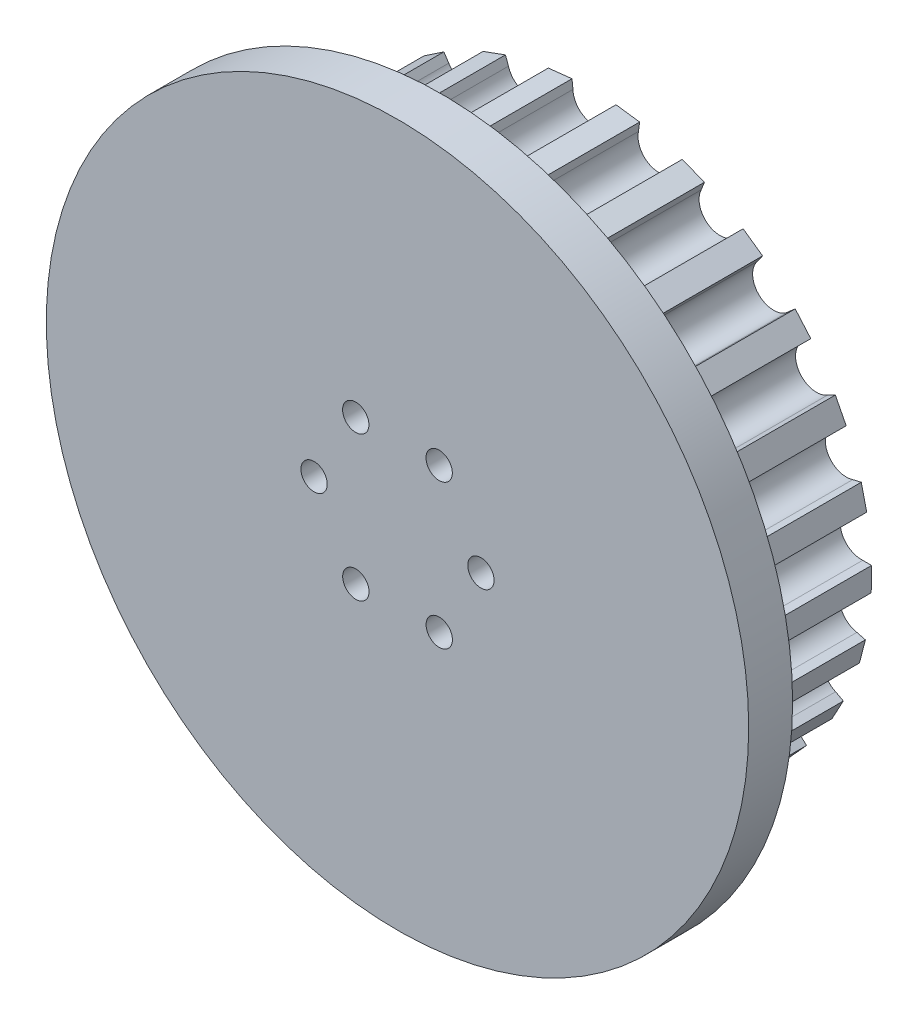
from build123d import *

# Parameters (mm, degrees)
BOSS_EXTRUDE4_DEPTH = 17
SKETCH6_R           = 40
BOSS_EXTRUDE5_DEPTH = 5
SKETCH9_R           = 22.5
CUT_EXTRUDE2_DEPTH  = 8.91448242
SKETCH10_R          = 1.5
CUT_EXTRUDE3_DEPTH  = 59.062300767


with BuildPart() as part:
    # Sketch2 → Boss-Extrude4 (new body)
    with BuildSketch(Plane.XY):
        with BuildLine():
            ThreePointArc((2.753920794, 30.877433835), (0.34063079, 28.610074808), (-2.017992552, 30.934248109))
            Line((-2.017992552, 30.934248109), (-2.126702362, 31.928321636))
            Line((-2.126702362, 31.928321636), (-4.824266539, 31.633321637))
            Line((-4.824266539, 31.633321637), (-4.715556729, 30.63924811))
            ThreePointArc((-4.715556729, 30.63924811), (-6.51610638, 27.860236315), (-9.362403491, 29.552417851))
            Line((-9.362403491, 29.552417851), (-9.705851758, 30.491589448))
            Line((-9.705851758, 30.491589448), (-12.254431503, 29.55959225))
            Line((-12.254431503, 29.55959225), (-11.910983235, 28.620420653))
            ThreePointArc((-11.910983235, 28.620420653), (-12.994151132, 25.491262155), (-16.162705571, 26.453108487))
            Line((-16.162705571, 26.453108487), (-16.72093233, 27.282796914))
            Line((-16.72093233, 27.282796914), (-18.97241345, 25.767966806))
            Line((-18.97241345, 25.767966806), (-18.414186691, 24.938278379))
            ThreePointArc((-18.414186691, 24.938278379), (-18.717023052, 21.640828495), (-22.023689951, 21.816440611))
            Line((-22.023689951, 21.816440611), (-22.764253092, 22.488427392))
            Line((-22.764253092, 22.488427392), (-24.587787689, 20.478800794))
            Line((-24.587787689, 20.478800794), (-23.847224548, 19.806814013))
            ThreePointArc((-23.847224548, 19.806814013), (-23.352129626, 16.532708544), (-26.604737525, 15.911880506))
            Line((-26.604737525, 15.911880506), (-27.48459821, 16.387112212))
            Line((-27.48459821, 16.387112212), (-28.774209082, 13.999481317))
            Line((-28.774209082, 13.999481317), (-27.894348397, 13.524249611))
            ThreePointArc((-27.894348397, 13.524249611), (-26.630095307, 10.463767667), (-29.639614458, 9.082579743))
            Line((-29.639614458, 9.082579743), (-30.607638382, 9.333437635))
            Line((-30.607638382, 9.333437635), (-31.288378032, 6.706562873))
            Line((-31.288378032, 6.706562873), (-30.320354108, 6.45570498))
            ThreePointArc((-30.320354108, 6.45570498), (-28.360416646, 3.786710647), (-30.951944734, 1.725432459))
            Line((-30.951944734, 1.725432459), (-31.951873866, 1.737337589))
            Line((-31.951873866, 1.737337589), (-31.984180179, -0.976116629))
            Line((-31.984180179, -0.976116629), (-30.984251048, -0.988021759))
            ThreePointArc((-30.984251048, -0.988021759), (-28.442533655, -3.110416231), (-30.465460488, -5.731990687))
            Line((-30.465460488, -5.731990687), (-31.43918258, -5.959730203))
            Line((-31.43918258, -5.959730203), (-30.821178033, -8.60206778))
            Line((-30.821178033, -8.60206778), (-29.847455941, -8.374328264))
            ThreePointArc((-29.847455941, -8.374328264), (-26.871673993, -9.826777024), (-28.208434416, -12.85629137))
            Line((-28.208434416, -12.85629137), (-29.09936028, -13.310440139))
            Line((-29.09936028, -13.310440139), (-27.866961049, -15.728098019))
            Line((-27.866961049, -15.728098019), (-26.976035185, -15.27394925))
            ThreePointArc((-26.976035185, -15.27394925), (-23.739130313, -15.972041255), (-24.312036669, -19.233431129))
            Line((-24.312036669, -19.233431129), (-25.068388933, -19.887595675))
            Line((-25.068388933, -19.887595675), (-23.293217582, -21.94006837))
            Line((-23.293217582, -21.94006837), (-22.536865318, -21.285903824))
            ThreePointArc((-22.536865318, -21.285903824), (-19.226954667, -21.189068505), (-19.002711722, -24.492793781))
            Line((-19.002711722, -24.492793781), (-19.58053394, -25.308956439))
            Line((-19.58053394, -25.308956439), (-17.365756976, -26.876961697))
            Line((-17.365756976, -26.876961697), (-16.787934758, -26.060799039))
            ThreePointArc((-16.787934758, -26.060799039), (-13.597378303, -25.174664112), (-12.589018241, -28.328724287))
            Line((-12.589018241, -28.328724287), (-12.954729488, -29.259452649))
            Line((-12.954729488, -29.259452649), (-10.429061697, -30.251863704))
            Line((-10.429061697, -30.251863704), (-10.063350451, -29.321135341))
            ThreePointArc((-10.063350451, -29.321135341), (-7.177571736, -27.697199747), (-5.44369678, -30.518292308))
            Line((-5.44369678, -30.518292308), (-5.576043245, -31.509495825))
            Line((-5.576043245, -31.509495825), (-2.88626726, -31.868637353))
            Line((-2.88626726, -31.868637353), (-2.753920794, -30.877433835))
            ThreePointArc((-2.753920794, -30.877433835), (-0.34063079, -28.610074808), (2.017992552, -30.934248109))
            Line((2.017992552, -30.934248109), (2.126702362, -31.928321636))
            Line((2.126702362, -31.928321636), (4.824266539, -31.633321637))
            Line((4.824266539, -31.633321637), (4.715556729, -30.63924811))
            ThreePointArc((4.715556729, -30.63924811), (6.51610638, -27.860236315), (9.362403491, -29.552417851))
            Line((9.362403491, -29.552417851), (9.705851758, -30.491589448))
            Line((9.705851758, -30.491589448), (12.254431503, -29.55959225))
            Line((12.254431503, -29.55959225), (11.910983235, -28.620420653))
            ThreePointArc((11.910983235, -28.620420653), (12.994151132, -25.491262155), (16.162705571, -26.453108487))
            Line((16.162705571, -26.453108487), (16.72093233, -27.282796914))
            Line((16.72093233, -27.282796914), (18.97241345, -25.767966806))
            Line((18.97241345, -25.767966806), (18.414186691, -24.938278379))
            ThreePointArc((18.414186691, -24.938278379), (18.717023052, -21.640828495), (22.023689951, -21.816440611))
            Line((22.023689951, -21.816440611), (22.764253092, -22.488427392))
            Line((22.764253092, -22.488427392), (24.587787689, -20.478800794))
            Line((24.587787689, -20.478800794), (23.847224548, -19.806814013))
            ThreePointArc((23.847224548, -19.806814013), (23.352129626, -16.532708544), (26.604737525, -15.911880506))
            Line((26.604737525, -15.911880506), (27.48459821, -16.387112212))
            Line((27.48459821, -16.387112212), (28.774209082, -13.999481317))
            Line((28.774209082, -13.999481317), (27.894348397, -13.524249611))
            ThreePointArc((27.894348397, -13.524249611), (26.630095307, -10.463767667), (29.639614458, -9.082579743))
            Line((29.639614458, -9.082579743), (30.607638382, -9.333437635))
            Line((30.607638382, -9.333437635), (31.288378032, -6.706562873))
            Line((31.288378032, -6.706562873), (30.320354108, -6.45570498))
            ThreePointArc((30.320354108, -6.45570498), (28.360416646, -3.786710647), (30.951944734, -1.725432459))
            Line((30.951944734, -1.725432459), (31.951873866, -1.737337589))
            Line((31.951873866, -1.737337589), (31.984180179, 0.976116629))
            Line((31.984180179, 0.976116629), (30.984251048, 0.988021759))
            ThreePointArc((30.984251048, 0.988021759), (28.442533655, 3.110416231), (30.465460488, 5.731990687))
            Line((30.465460488, 5.731990687), (31.43918258, 5.959730203))
            Line((31.43918258, 5.959730203), (30.821178033, 8.60206778))
            Line((30.821178033, 8.60206778), (29.847455941, 8.374328264))
            ThreePointArc((29.847455941, 8.374328264), (26.871673993, 9.826777024), (28.208434416, 12.85629137))
            Line((28.208434416, 12.85629137), (29.09936028, 13.310440139))
            Line((29.09936028, 13.310440139), (27.866961049, 15.728098019))
            Line((27.866961049, 15.728098019), (26.976035185, 15.27394925))
            ThreePointArc((26.976035185, 15.27394925), (23.739130313, 15.972041255), (24.312036669, 19.233431129))
            Line((24.312036669, 19.233431129), (25.068388933, 19.887595675))
            Line((25.068388933, 19.887595675), (23.293217582, 21.94006837))
            Line((23.293217582, 21.94006837), (22.536865318, 21.285903824))
            ThreePointArc((22.536865318, 21.285903824), (19.226954667, 21.189068505), (19.002711722, 24.492793781))
            Line((19.002711722, 24.492793781), (19.58053394, 25.308956439))
            Line((19.58053394, 25.308956439), (17.365756976, 26.876961697))
            Line((17.365756976, 26.876961697), (16.787934758, 26.060799039))
            ThreePointArc((16.787934758, 26.060799039), (13.597378303, 25.174664112), (12.589018241, 28.328724287))
            Line((12.589018241, 28.328724287), (12.954729488, 29.259452649))
            Line((12.954729488, 29.259452649), (10.429061697, 30.251863704))
            Line((10.429061697, 30.251863704), (10.063350451, 29.321135341))
            ThreePointArc((10.063350451, 29.321135341), (7.177571736, 27.697199747), (5.44369678, 30.518292308))
            Line((5.44369678, 30.518292308), (5.576043245, 31.509495825))
            Line((5.576043245, 31.509495825), (2.88626726, 31.868637353))
            Line((2.88626726, 31.868637353), (2.753920794, 30.877433835))
        make_face()
    extrude(amount=-BOSS_EXTRUDE4_DEPTH)

    # Sketch6 → Boss-Extrude5 (add)
    with BuildSketch(Plane.XY):
        Circle(SKETCH6_R)
    extrude(amount=BOSS_EXTRUDE5_DEPTH)

    # Sketch9 → Cut-Extrude2 (cut)
    with BuildSketch(Plane(origin=(0, 0, -17), x_dir=(-1, 0, 0), z_dir=(0, 0, -1))):
        Circle(SKETCH9_R)
    extrude(amount=-CUT_EXTRUDE2_DEPTH, mode=Mode.SUBTRACT)

    # Sketch10 → Cut-Extrude3 (cut, through all)
    with BuildSketch(Plane(origin=(0, 0, -8.08551758), x_dir=(-1, 0, 0), z_dir=(0, 0, -1))):
        with Locations((-4.744582961, 8.230366488)):
            Circle(SKETCH10_R)
        with Locations((4.75541498, 8.224112619)):
            Circle(SKETCH10_R)
        with Locations((9.499997942, -0.006253869)):
            Circle(SKETCH10_R)
        with Locations((4.744582961, -8.230366488)):
            Circle(SKETCH10_R)
        with Locations((-4.75541498, -8.224112619)):
            Circle(SKETCH10_R)
        with Locations((-9.499997942, 0.006253869)):
            Circle(SKETCH10_R)
    extrude(amount=-CUT_EXTRUDE3_DEPTH, mode=Mode.SUBTRACT)


solid = part.part
